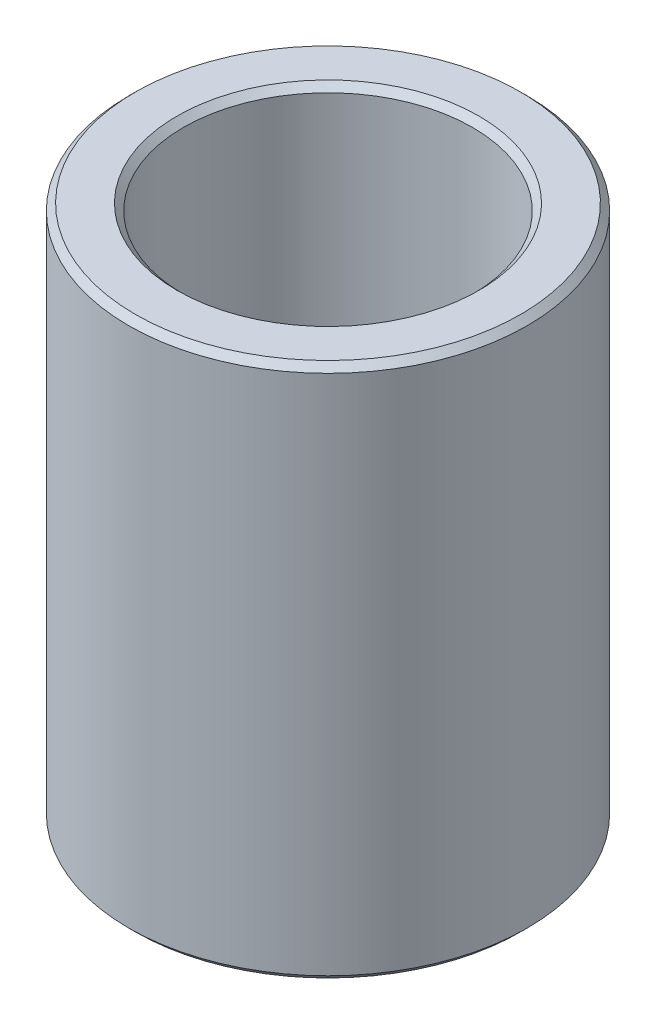
from build123d import *

# Parameters (mm, degrees)
SKETCH1_R           = 42.5
BOSS_EXTRUDE1_DEPTH = 114.113695182
SKETCH2_R           = 30.831355446
CUT_EXTRUDE1_DEPTH  = 129.974553413
CHAMFER1_SIZE       = 1.392557685


with BuildPart() as part:
    # Sketch1 → Boss-Extrude1 (new body)
    with BuildSketch(Plane(origin=(0, 0, 0), x_dir=(1, 0, 0), z_dir=(0, 1, 0))):
        Circle(SKETCH1_R)
    extrude(amount=BOSS_EXTRUDE1_DEPTH)

    # Sketch2 → Cut-Extrude1 (cut, through all)
    with BuildSketch(Plane(origin=(0, 0, 0), x_dir=(1, 0, 0), z_dir=(0, 1, 0))):
        Circle(SKETCH2_R)
    extrude(amount=CUT_EXTRUDE1_DEPTH, mode=Mode.SUBTRACT)

    # Chamfer1
    chamfer1_edges = [part.edges().sort_by_distance(p)[0] for p in [
        (-30.831355446, 114.113695182, 0),
        (-30.831355446, 0, 0),
        (-42.5, 0, 0),
        (-42.5, 114.113695182, 0),
    ]]
    chamfer(chamfer1_edges, length=CHAMFER1_SIZE)


solid = part.part
